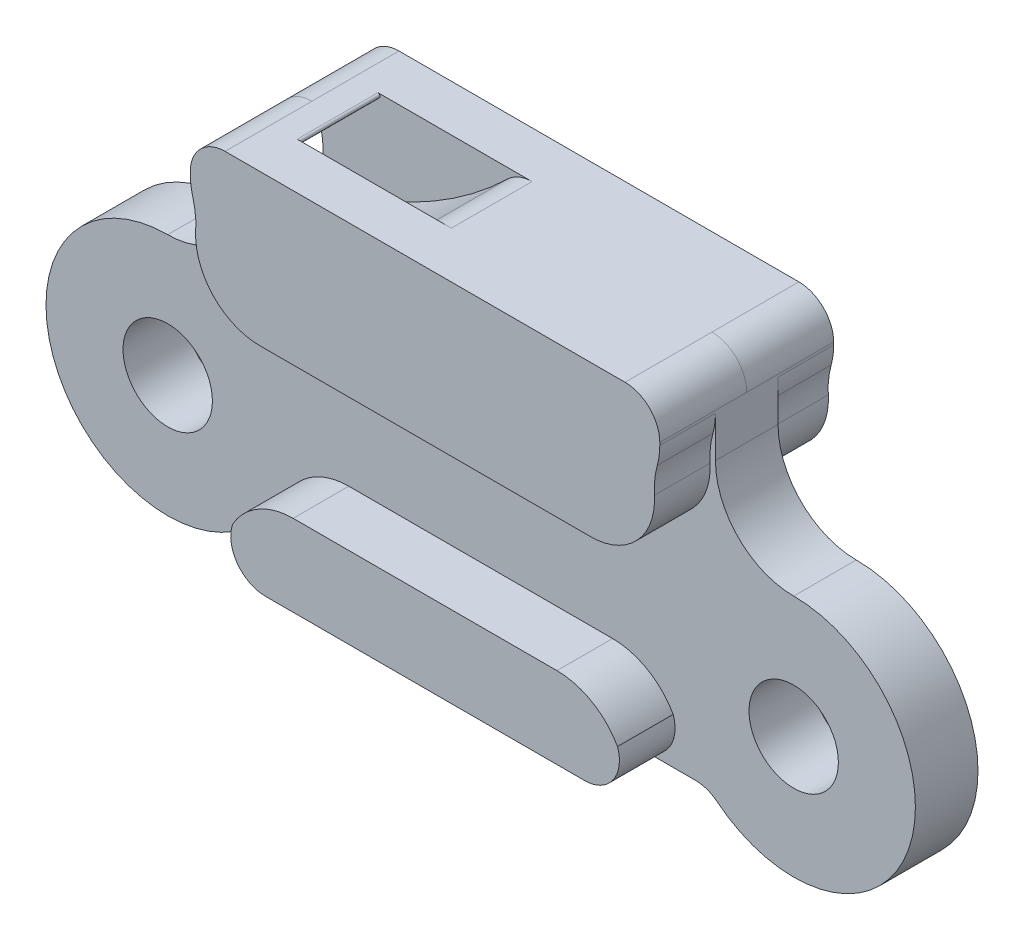
from build123d import *

# Parameters (mm, degrees)
SKETCH2_R           = 5.556250000000001
SKETCH2_R_2         = 2.039937499999998
BOSS_EXTRUDE1_DEPTH = 3.96875
CUT_EXTRUDE1_START  = -2.54
SKETCH3_R           = 2.039937499999998
CUT_EXTRUDE1_DEPTH  = 2.54
FILLET1_R           = 1.5875
FILLET2_R           = 3.175
CUT_EXTRUDE2_START  = -2.12725
SKETCH4_R           = 17.604048203812315
SKETCH4_R_2         = 13.921048203812312
CUT_EXTRUDE2_DEPTH  = 1.8415
MIRROR1_START       = -3.96875
MIRROR1_DEPTH       = 3.96875
MIRROR1_START_2     = -1.42875
MIRROR1_2_OUTLINE_R = 2.0399375
MIRROR1_2_DEPTH     = 1.42875
MIRROR1_3_DEPTH     = 2.12725
FILLET3_R           = 1.5875
FILLET4_R           = 0.1984375
FILLET5_R           = 0.09921875


with BuildPart() as part:
    # Sketch2 → Boss-Extrude1 (new body)
    # profile 1 of 3: a face of its own
    with BuildSketch(Plane.XY):
        with Locations((-14.2875, 0)):
            Circle(SKETCH2_R)
        with Locations((-14.2875, 0)):
            Circle(SKETCH2_R_2, mode=Mode.SUBTRACT)
    # profile 2 of 3: a face of its own
    with BuildSketch(Plane.XY):
        with Locations((14.2875, 0)):
            Circle(SKETCH2_R)
        with Locations((14.2875, 0)):
            Circle(SKETCH2_R_2, mode=Mode.SUBTRACT)
    # profile 3 of 3: a face of its own
    with BuildSketch(Plane.XY):
        with BuildLine():
            Line((-10.715625, 12.699999999999998), (-10.715625, 9.128124999999997))
            ThreePointArc((-10.715625, 9.128124999999997), (-11.76180296762913, 6.6024279642694665), (-14.28750000475128, 5.556249999999996))
            ThreePointArc((-14.287500004751278, 5.556250000000001), (-10.358637948712076, 3.9288620546475865), (-8.73125, 0))
            ThreePointArc((-8.73125, -1.36e-15), (-9.165110266752894, -2.1524491824952943), (-10.398935033331705, -3.968750000000002))
            Line((-10.398935033331705, -3.9687500000000018), (10.398935033331705, -3.9687500000000018))
            ThreePointArc((10.398935033331703, -3.968750000000001), (9.143412067733138, 2.1000650960402263), (14.287499984624889, 5.556250000000001))
            ThreePointArc((14.287499984624889, 5.556249999999996), (11.761802960513377, 6.60242797138522), (10.715625, 9.128124999999997))
            Line((10.715625, 9.128124999999997), (10.715625, 12.699999999999998))
            Line((10.715625, 12.699999999999998), (0, 12.699999999999998))
            Line((0, 12.699999999999998), (-10.715625, 12.699999999999998))
        make_face()
    extrude(amount=BOSS_EXTRUDE1_DEPTH)

    # Sketch3 → Cut-Extrude1 (cut)
    with BuildSketch(Plane.XY.offset(3.96875).offset(CUT_EXTRUDE1_START)):
        with BuildLine():
            ThreePointArc((-7.552307909198136, 5.810250000000002), (-9.677647571923792, 6.727460510546287), (-10.468249900083975, 8.903073472752357))
            ThreePointArc((-10.468249900083975, 8.903073472752357), (-10.506779246316498, 9.714188220388294), (-10.715624999999989, 10.498901604702587))
            Line((-10.715625, 10.498901604702585), (-10.715625, 9.128124999999997))
            ThreePointArc((-10.715624999999998, 9.128124999999997), (-11.76180296762913, 6.6024279642694665), (-14.28750000475128, 5.556249999999997))
            ThreePointArc((-14.28750000475128, 5.556250000000002), (-19.43158792846333, -2.1000651053569315), (-10.398935033331707, -3.9687500000000058))
            Line((-10.398935033331705, -3.9687500000000018), (-10.043913250562724, -3.9687500000000018))
            ThreePointArc((-10.043913250562714, -3.968750000000039), (-8.931023957684667, -2.251037420968806), (-8.482804567636641, -0.2540000000000033))
            Line((-8.482804567636643, -0.254), (8.482804567636643, -0.254))
            ThreePointArc((8.482804567636641, -0.25399999999999856), (8.93102395768462, -2.2510374209686943), (10.043913250562554, -3.968749999999868))
            Line((10.04391325056251, -3.9687500000000018), (10.398935033331705, -3.9687500000000018))
            ThreePointArc((10.398935033331703, -3.968750000000001), (19.431587932266865, -2.1000650960402254), (14.287499984624894, 5.556250000000003))
            ThreePointArc((14.28749998462489, 5.556249999999997), (11.761802960513378, 6.60242797138522), (10.715625, 9.128124999999997))
            Line((10.715625, 9.128124999999997), (10.715625, 10.498901604702809))
            ThreePointArc((10.715625000000067, 10.498901604702796), (10.506779255556298, 9.71418827999466), (10.468249892987725, 8.903073593179762))
            ThreePointArc((10.468249892987725, 8.90307359317976), (9.6776476133017, 6.727460554434185), (7.552307909198134, 5.810250000000002))
            Line((7.552307909198135, 5.810250000000002), (0, 5.810250000000002))
            Line((0, 5.810250000000002), (-7.552307909198135, 5.810250000000002))
        make_face()
        with Locations((-14.2875, 0)):
            Circle(SKETCH3_R, mode=Mode.SUBTRACT)
        with Locations((14.2875, 0)):
            Circle(SKETCH3_R, mode=Mode.SUBTRACT)
    extrude(amount=CUT_EXTRUDE1_DEPTH, mode=Mode.SUBTRACT)

    # Fillet1
    fillet1_edges = [part.edges().sort_by_distance(p)[0] for p in [
        (-10.715625, 12.699999999999998, 1.984375),
        (10.715625, 12.699999999999998, 1.984375),
        (10.043913250562532, -3.968749999999936, 2.69875),
        (-10.043913250562719, -3.9687500000000204, 2.69875),
    ]]
    fillet(fillet1_edges, radius=FILLET1_R)

    # Fillet2
    # the kernel refuses this fillet: 3.175 mm, written as the material it takes off along each edge
    with BuildSketch(Plane(origin=(10.715625000000033, 10.498901604702802, 1.42875), x_dir=(-0.3129675525717291, -0.9497638185555723, 0), z_dir=(0, 0, 1))) as fillet2_piece_1:
        with BuildLine():
            CenterArc((0.5207906104453346, -3.1713246792527547), FILLET2_R, 92.75711760707199, 15.4810427085975)
            Line((-0.47288136896990385, -0.15582455533881112), (0, 0))
            ThreePointArc((0, 0), (0.1840330456266841, -0.00442876150043089), (0.3680660912533638, 0))
        make_face()
    extrude(amount=3.784734111079021, mode=Mode.SUBTRACT)
    with BuildSketch(Plane(origin=(-10.715624999999994, 10.498901604702585, 1.42875), x_dir=(0.31296755257180836, -0.949763818555546, 0), z_dir=(0, 0, 1))) as fillet2_piece_2:
        with BuildLine():
            CenterArc((0.520790610445383, 3.1713246792527405), FILLET2_R, 251.7618396843257, 15.481042708597613)
            Line((-0.4728813689701088, 0.1558245553388813), (0, 0))
            ThreePointArc((0, 0), (0.18403304562657702, 0.00442876150044717), (0.3680660912531513, -1e-17))
        make_face()
    extrude(amount=3.784734111079562, mode=Mode.SUBTRACT)
    with BuildSketch(Plane(origin=(8.482804567636641, -0.25399999999999934, 1.42875), x_dir=(0.18466066844771437, -0.9828023389921513, 0), z_dir=(0, 0, 1))) as fillet2_piece_3:
        with BuildLine():
            CenterArc((2.665698104684143, -3.006301625224905), FILLET2_R, 108.76131112774725, 60.59733959481885)
            Line((-0.4546993216159375, -2.4200040029034118), (0, 0))
            ThreePointArc((0, 0), (0.8222671445716088, -0.05847794215052012), (1.644534289143218, 1e-17))
        make_face()
    extrude(amount=8.695876687740405, mode=Mode.SUBTRACT)
    with BuildSketch(Plane(origin=(-8.482804567636641, -0.2540000000000016, 1.42875), x_dir=(1, 6.5e-16, 0), z_dir=(0, 0, 1))) as fillet2_piece_4:
        with BuildLine():
            CenterArc((2.462350675096158, -3.175), FILLET2_R, 89.99999999999996, 60.59733959481888)
            ThreePointArc((-0.3036808011183762, -1.6162521459227466), (-0.09436814223421007, -0.8189246488483356), (0, 0))
            Line((0, 0), (2.46235067509616, 0))
        make_face()
    extrude(amount=8.695876687740402, mode=Mode.SUBTRACT)

    # Sketch4 → Cut-Extrude2 (cut)
    with BuildSketch(Plane.XY.offset(3.96875).offset(CUT_EXTRUDE2_START)):
        with Locations((-14.2875, 24.89067320381231)):
            Circle(SKETCH4_R)
        with Locations((-14.2875, 24.89067320381231)):
            Circle(SKETCH4_R_2, mode=Mode.SUBTRACT)
    extrude(amount=-CUT_EXTRUDE2_DEPTH, mode=Mode.SUBTRACT)

    # Mirror1: read off the stored shape, not the designer's step
    # Mirror1 outline → Mirror1 (add)
    with BuildSketch(Plane.XY.offset(MIRROR1_START)):
        with BuildLine():
            ThreePointArc((-1.5875, 12.7), (-5.58418864, 9.588552941), (-10.301362468, 7.743859484))
            ThreePointArc((-10.301362468, 7.743859484), (-9.232794937, 6.342065129), (-7.552307909, 5.81025))
            Line((-7.552307909, 5.81025), (7.552307909, 5.81025))
            ThreePointArc((7.552307909, 5.81025), (9.677647591, 6.727460531), (10.468249897, 8.903073529))
            ThreePointArc((10.468249897, 8.903073529), (10.482964805, 9.531648806), (10.600432256, 10.149325748))
            ThreePointArc((10.600432256, 10.149325748), (10.686695012, 10.569164005), (10.715625, 10.996795249))
            Line((10.715625, 10.996795249), (10.715625, 11.1125))
            ThreePointArc((10.715625, 11.1125), (10.250657015, 12.235032015), (9.128125, 12.7))
            Line((9.128125, 12.7), (-1.5875, 12.7))
        make_face()
        with BuildLine():
            ThreePointArc((-8.786485369, -1.870252146), (-8.5740892, -3.3056274), (-7.283475907, -3.96875))
            Line((-7.283475907, -3.96875), (7.283475907, -3.96875))
            ThreePointArc((7.283475907, -3.96875), (8.5740892, -3.3056274), (8.786485369, -1.870252146))
            ThreePointArc((8.786485369, -1.870252146), (7.622265455, -0.687681938), (6.020453893, -0.254))
            Line((6.020453893, -0.254), (-6.020453893, -0.254))
            ThreePointArc((-6.020453893, -0.254), (-7.622265455, -0.687681938), (-8.786485369, -1.870252146))
        make_face()
        with BuildLine():
            ThreePointArc((-10.680399967, 11.445063792), (-9.085054176, 11.978270618), (-7.56566469, 12.7))
            Line((-7.56566469, 12.7), (-9.128125, 12.7))
            ThreePointArc((-9.128125, 12.7), (-10.126175908, 12.347024457), (-10.680399967, 11.445063792))
        make_face()
    extrude(amount=MIRROR1_DEPTH)

    # Mirror1 2 outline → Mirror1 2 (add)
    with BuildSketch(Plane.XY.offset(MIRROR1_START_2)):
        with BuildLine():
            ThreePointArc((-10.301362468, 7.743859484), (-10.683167713, 7.659558848), (-11.066751055, 7.583758707))
            ThreePointArc((-11.066751055, 7.583758707), (-12.384606458, 6.105330402), (-14.2875, 5.55625))
            ThreePointArc((-14.2875, 5.55625), (-19.431587929, -2.100065103), (-10.398935033, -3.96875))
            Line((-10.398935033, -3.96875), (-7.283475907, -3.96875))
            ThreePointArc((-7.283475907, -3.96875), (-8.5740892, -3.3056274), (-8.786485369, -1.870252146))
            ThreePointArc((-8.786485369, -1.870252146), (-7.622265455, -0.687681938), (-6.020453893, -0.254))
            Line((-6.020453893, -0.254), (6.020453893, -0.254))
            ThreePointArc((6.020453893, -0.254), (7.622265455, -0.687681938), (8.786485369, -1.870252146))
            ThreePointArc((8.786485369, -1.870252146), (8.5740892, -3.3056274), (7.283475907, -3.96875))
            Line((7.283475907, -3.96875), (10.398935033, -3.96875))
            ThreePointArc((10.398935033, -3.96875), (19.431587929, -2.100065103), (14.2875, 5.55625))
            ThreePointArc((14.2875, 5.55625), (11.761802966, 6.602427966), (10.715625, 9.128125))
            Line((10.715625, 9.128125), (10.715625, 10.996795249))
            ThreePointArc((10.715625, 10.996795249), (10.686695012, 10.569164005), (10.600432256, 10.149325748))
            ThreePointArc((10.600432256, 10.149325748), (10.482964805, 9.531648806), (10.468249897, 8.903073529))
            ThreePointArc((10.468249897, 8.903073529), (9.677647591, 6.727460531), (7.552307909, 5.81025))
            Line((7.552307909, 5.81025), (-7.552307909, 5.81025))
            ThreePointArc((-7.552307909, 5.81025), (-9.232794937, 6.342065129), (-10.301362468, 7.743859484))
        make_face()
        with Locations((-14.2875, 0)):
            Circle(MIRROR1_2_OUTLINE_R, mode=Mode.SUBTRACT)
        with Locations((14.2875, 0)):
            Circle(MIRROR1_2_OUTLINE_R, mode=Mode.SUBTRACT)
    extrude(amount=MIRROR1_2_DEPTH)

    # Mirror1 3 outline → Mirror1 3 (add)
    with BuildSketch(Plane.XY.offset(MIRROR1_START)):
        with BuildLine():
            ThreePointArc((-10.468249897, 8.903073529), (-10.443499838, 8.315016615), (-10.301362468, 7.743859484))
            ThreePointArc((-10.301362468, 7.743859484), (-5.58418864, 9.588552941), (-1.5875, 12.7))
            Line((-1.5875, 12.7), (-7.56566469, 12.7))
            ThreePointArc((-7.56566469, 12.7), (-9.085054176, 11.978270618), (-10.680399967, 11.445063792))
            ThreePointArc((-10.680399967, 11.445063792), (-10.70679418, 11.27971205), (-10.715625, 11.1125))
            Line((-10.715625, 11.1125), (-10.715625, 10.996795249))
            ThreePointArc((-10.715625, 10.996795249), (-10.686695012, 10.569164005), (-10.600432256, 10.149325748))
            ThreePointArc((-10.600432256, 10.149325748), (-10.482964805, 9.531648806), (-10.468249897, 8.903073529))
        make_face()
    extrude(amount=MIRROR1_3_DEPTH)

    # Fillet3
    fillet3_edges = [part.edges().sort_by_distance(p)[0] for p in [
        (-1.5875000000000001, 12.7, -0.92075),
        (-11.0667510545982, 7.583758707206023, 0.714375),
        (10.398935033331703, -3.9687500000000013, 0.714375),
        (-10.398935033331705, -3.9687500000000018, 0.714375),
    ]]
    fillet(fillet3_edges, radius=FILLET3_R)

    # Fillet4
    # the kernel refuses this fillet: 0.1984375 mm, written as the material it takes off along each edge
    with BuildSketch(Plane(origin=(-10.680399967281256, 11.445063792304536, 0), x_dir=(0.9621801124041967, 0.2724140805719251, 0), z_dir=(0, 0, 1))) as fillet4_piece_1:
        with BuildLine():
            CenterArc((0.38144862686573777, 0.1984186072365745), FILLET4_R, 137.3415044379145, 133.4491322184)
            ThreePointArc((0.2355165674481968, 0.3328852404226754), (0.10702546563184087, 0.17403609738966894), (0, 0))
            ThreePointArc((0, 0), (0.1920934106306479, -0.00132538996079977), (0.384186821261299, 0))
        make_face()
    extrude(amount=1.8415, mode=Mode.SUBTRACT)
    with BuildSketch(Plane(origin=(-10.680399967, 11.445063791999997, -1.8415), x_dir=(0.962180112277252, 0.2724140810203004, 0), z_dir=(0, 0, 1))) as fillet4_piece_2:
        with BuildLine():
            CenterArc((0.3814486268633621, 0.19841860723671206), FILLET4_R, 137.34150443483912, 133.44913221859187)
            ThreePointArc((0.23551656745303873, 0.3328852404306458), (0.10702546562937841, 0.17403609739708187), (0, 0))
            ThreePointArc((0, 0), (0.19209341062446852, -0.00132538995592385), (0.38418682124893766, 1e-17))
        make_face()
    extrude(amount=1.8415, mode=Mode.SUBTRACT)

    # Fillet5
    fillet5_edges = [part.edges().sort_by_distance(p)[0] for p in [
        (-7.565664690300835, 12.699999999999998, 0.92075),
    ]]
    fillet(fillet5_edges, radius=FILLET5_R)


solid = part.part
